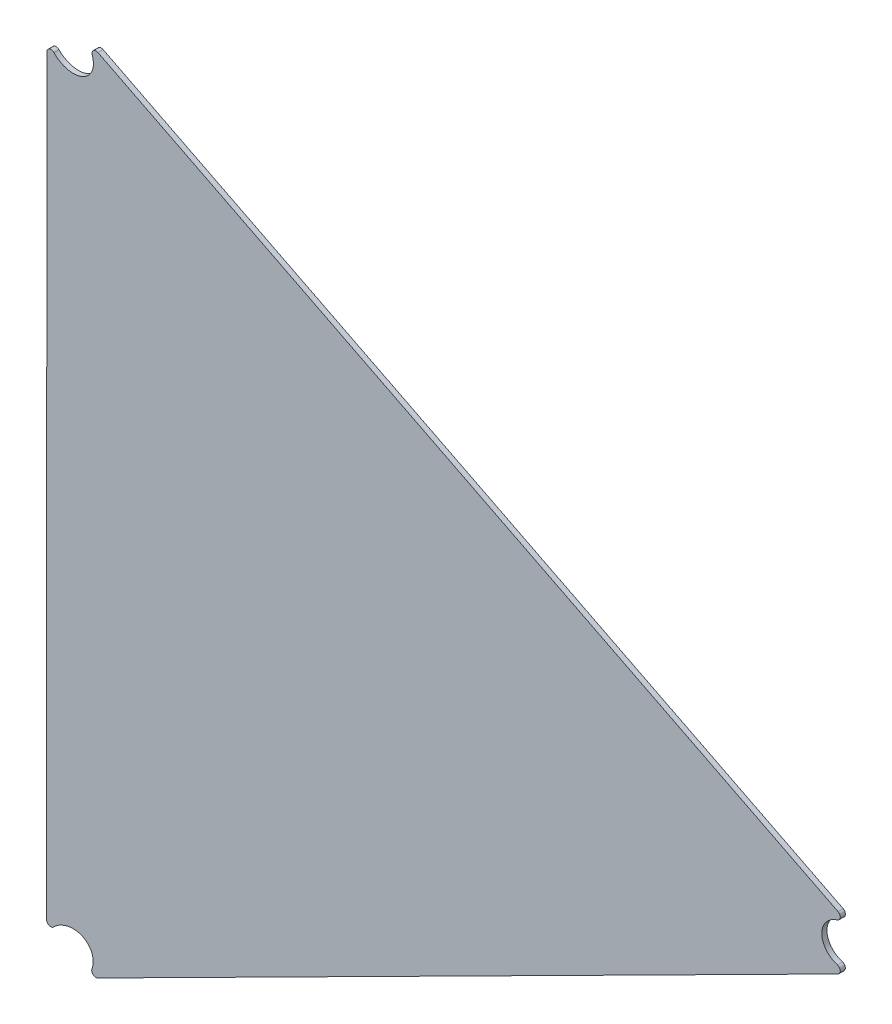
from build123d import *

# Parameters (mm, degrees)
BOSS_EXTRUDE1_DEPTH = 3.175
FILLET1_START       = -1
FILLET1_DEPTH       = 5


with BuildPart() as part:
    # Sketch2 → Boss-Extrude1 (new body)
    with BuildSketch(Plane.XY):
        with BuildLine():
            Line((252.882647522, 18.233509916), (-227.808389099, 261.102259727))
            add(Edge.make_bspline(
                [(-227.808389099, 261.102259727), (-218.508408171, 256.403452033), (-217.090340448, 248.048262702), (-220.367085383, 242.285684549)],
                knots=[0.742781474, 0.742781474, 0.742781474, 0.742781474, 1, 1, 1, 1], degree=3, weights=[0.500416857, 0.490514251, 0.657041966, 1]))
            add(Edge.make_bspline(
                [(-220.367085383, 242.285684549), (-227.805809429, 229.203729887), (-247.735230176, 231.479633917), (-247.728634027, 251.479512649)],
                knots=[0, 0, 0, 0, 0.406744285, 0.406744285, 0.406744285, 0.406744285], degree=3, weights=[1, 0.457674286, 0.356524342, 0.696550168]))
            Line((-247.728634027, 251.479512649), (-247.88971408, -236.923885776))
            add(Edge.make_bspline(
                [(-247.88971408, -236.923885776), (-247.883118871, -216.926855588), (-227.957336221, -214.663599199), (-220.525871765, -227.745847533)],
                knots=[0.593296933, 0.593296933, 0.593296933, 0.593296933, 1, 1, 1, 1], degree=3, weights=[0.696446809, 0.356544847, 0.457729245, 1]))
            add(Edge.make_bspline(
                [(-220.525871765, -227.745847533), (-217.251599097, -233.509832332), (-218.672940969, -241.864237022), (-227.974334939, -246.55870873)],
                knots=[0, 0, 0, 0, 0.25721856, 0.25721856, 0.25721856, 0.25721856], degree=3, weights=[1, 0.65704192, 0.490514207, 0.500416861]))
            Line((-227.974334939, -246.55870873), (252.876255857, -3.870408269))
            add(Edge.make_bspline(
                [(252.876255857, -3.870408269), (240.565044662, -10.083953555), (231.629829811, -2.056184754), (231.628366282, 7.18068181)],
                knots=[0.684200569, 0.684200569, 0.684200569, 0.684200569, 1, 1, 1, 1], degree=3, weights=[0.534636521, 0.423812933, 0.578934092, 1]))
            add(Edge.make_bspline(
                [(231.628366282, 7.18068181), (231.626901898, 16.422942754), (240.567824747, 24.455563967), (252.882647522, 18.233509916)],
                knots=[0, 0, 0, 0, 0.315906176, 0.315906176, 0.315906176, 0.315906176], degree=3, weights=[1, 0.578791765, 0.423708096, 0.534748993]))
        make_face()
    extrude(amount=BOSS_EXTRUDE1_DEPTH)

    # Fillet1: read off the stored shape, not the designer's step
    # Fillet1 outline → Fillet1 (cut)
    with BuildSketch(Plane.XY.offset(FILLET1_START)):
        with BuildLine():
            Line((-247.728634027, 251.479512649), (-247.73250842, 239.732143832))
            ThreePointArc((-247.73250842, 239.732143832), (-246.154410329, 242.082124056), (-243.381643145, 241.512419941))
            add(Edge.make_bspline(
                [(-243.381643145, 241.512419941), (-246.348546976, 244.528882707), (-247.729754583, 248.081924898), (-247.728634027, 251.479512649)],
                knots=[1.290568731, 1.290568731, 1.290568731, 1.290568731, 1.406744285, 1.406744285, 1.406744285, 1.406744285], degree=3, weights=[0.513166576, 0.538303082, 0.599430946, 0.696550168]))
        make_face()
        with BuildLine():
            ThreePointArc((-243.536134042, -226.959195307), (-246.309281681, -227.52709022), (-247.885839538, -225.176065383))
            Line((-247.885839538, -225.176065383), (-247.88971408, -236.923885776))
            add(Edge.make_bspline(
                [(-247.88971408, -236.923885776), (-247.888593429, -233.526010078), (-246.504981138, -229.973706223), (-243.536134042, -226.959195307)],
                knots=[0.593296933, 0.593296933, 0.593296933, 0.593296933, 0.709466339, 0.709466339, 0.709466339, 0.709466339], degree=3, weights=[0.696446809, 0.599358264, 0.538257269, 0.513143822]))
        make_face()
        with BuildLine():
            add(Edge.make_bspline(
                [(-227.808389099, 261.102259727), (-223.785212041, 259.069552836), (-220.970894654, 255.819508956), (-219.668408897, 252.094046153)],
                knots=[0.742781474, 0.742781474, 0.742781474, 0.742781474, 0.855317926, 0.855317926, 0.855317926, 0.855317926], degree=3, weights=[0.500416857, 0.496084338, 0.525523694, 0.588734925]))
            ThreePointArc((-219.668408897, 252.094046153), (-218.944883502, 254.842497831), (-216.125289867, 255.199383475))
            Line((-216.125289867, 255.199383475), (-227.808389099, 261.102259727))
        make_face()
        with BuildLine():
            ThreePointArc((-216.289382855, -240.661240335), (-219.108792384, -240.303160787), (-219.831184056, -237.554444482))
            add(Edge.make_bspline(
                [(-219.831184056, -237.554444482), (-221.135109685, -241.279221567), (-223.950577298, -244.527893084), (-227.974334939, -246.55870873)],
                knots=[1.144682938, 1.144682938, 1.144682938, 1.144682938, 1.25721856, 1.25721856, 1.25721856, 1.25721856], degree=3, weights=[0.588733468, 0.525523222, 0.496084353, 0.500416861]))
            Line((-227.974334939, -246.55870873), (-216.289382855, -240.661240335))
        make_face()
        with BuildLine():
            Line((252.882647522, 18.233509916), (241.670605569, 23.898384866))
            ThreePointArc((241.670605569, 23.898384866), (243.055767599, 21.412939134), (241.265285671, 19.201539396))
            add(Edge.make_bspline(
                [(241.265285671, 19.201539396), (245.20247003, 20.400808532), (249.313639066, 20.036748495), (252.882647522, 18.233509916)],
                knots=[1.208515124, 1.208515124, 1.208515124, 1.208515124, 1.315906176, 1.315906176, 1.315906176, 1.315906176], degree=3, weights=[0.513767959, 0.490007402, 0.49700108, 0.534748993]))
        make_face()
        with BuildLine():
            ThreePointArc((241.25790796, -4.833713175), (243.047416072, -7.045891114), (241.661178159, -9.530728124))
            Line((241.661178159, -9.530728124), (252.876255857, -3.870408269))
            add(Edge.make_bspline(
                [(252.876255857, -3.870408269), (249.305839521, -5.672419724), (245.194273266, -6.034625453), (241.25790796, -4.833713175)],
                knots=[0.684200569, 0.684200569, 0.684200569, 0.684200569, 0.791591528, 0.791591528, 0.791591528, 0.791591528], degree=3, weights=[0.534636521, 0.49694978, 0.49001722, 0.513838842]))
        make_face()
    extrude(amount=FILLET1_DEPTH, mode=Mode.SUBTRACT)


solid = part.part
